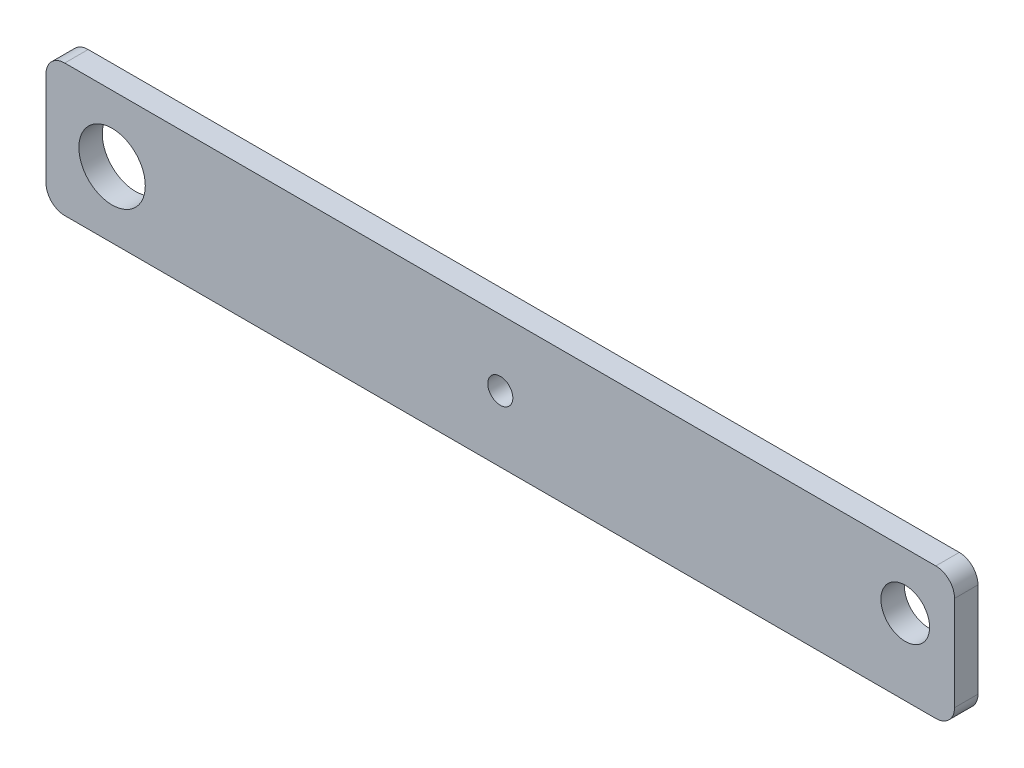
from build123d import *

# Parameters (mm, degrees)
SKETCH1_W            = 123.075797847
SKETCH1_H            = 17.9
SKETCH1_R            = 2
SKETCH1_R_2          = 2.54
BASE_FLANGE1_DEPTH   = 3.175
FILLET1_R            = 2.54
M8_CLEARANCE_HOLE1_D = 9
M6_CLEARANCE_HOLE1_D = 6.6
SKETCH10_R           = 1
CUT_EXTRUDE1_DEPTH   = 79.592687586
M3_CLEARANCE_HOLE2_D = 3.4


# Sheet-metal steps are written as plain solids
with BuildPart() as part:
    # Sketch1 → Base-Flange1 (new body)
    with BuildSketch(Plane.XY):
        with Locations((13.466115103, 14.312153748)):
            Rectangle(SKETCH1_W, SKETCH1_H)
        with Locations((-39.121783821, 14.312153748)):
            Circle(SKETCH1_R, mode=Mode.SUBTRACT)
        with Locations((68.323814026, 15.635739427)):
            Circle(SKETCH1_R_2, mode=Mode.SUBTRACT)
    extrude(amount=-BASE_FLANGE1_DEPTH)

    # Fillet1
    fillet1_edges = [part.edges().sort_by_distance(p)[0] for p in [
        (-48.071783821, 23.262153748, -1.5875),
        (75.004014026, 23.262153748, -1.5875),
        (75.004014026, 5.362153748, -1.5875),
        (-48.071783821, 5.362153748, -1.5875),
    ]]
    fillet(fillet1_edges, radius=FILLET1_R)

    # M8 Clearance Hole1 (through all)
    with Locations(Plane.XY):
        with Locations((-39.121783821, 14.312153748)):
            Hole(M8_CLEARANCE_HOLE1_D / 2)

    # M6 Clearance Hole1 (through all)
    with Locations(Plane.XY):
        with Locations((68.323814026, 15.635739427)):
            Hole(M6_CLEARANCE_HOLE1_D / 2)

    # Sketch10 → Cut-Extrude1 (cut, through all)
    with BuildSketch(Plane.XY):
        with Locations((13.466115103, 14.312153748)):
            Circle(SKETCH10_R)
    extrude(amount=-CUT_EXTRUDE1_DEPTH, mode=Mode.SUBTRACT)

    # M3 Clearance Hole2 (through all)
    with Locations(Plane.XY):
        with Locations((13.466115103, 14.312153748)):
            Hole(M3_CLEARANCE_HOLE2_D / 2)


solid = part.part
